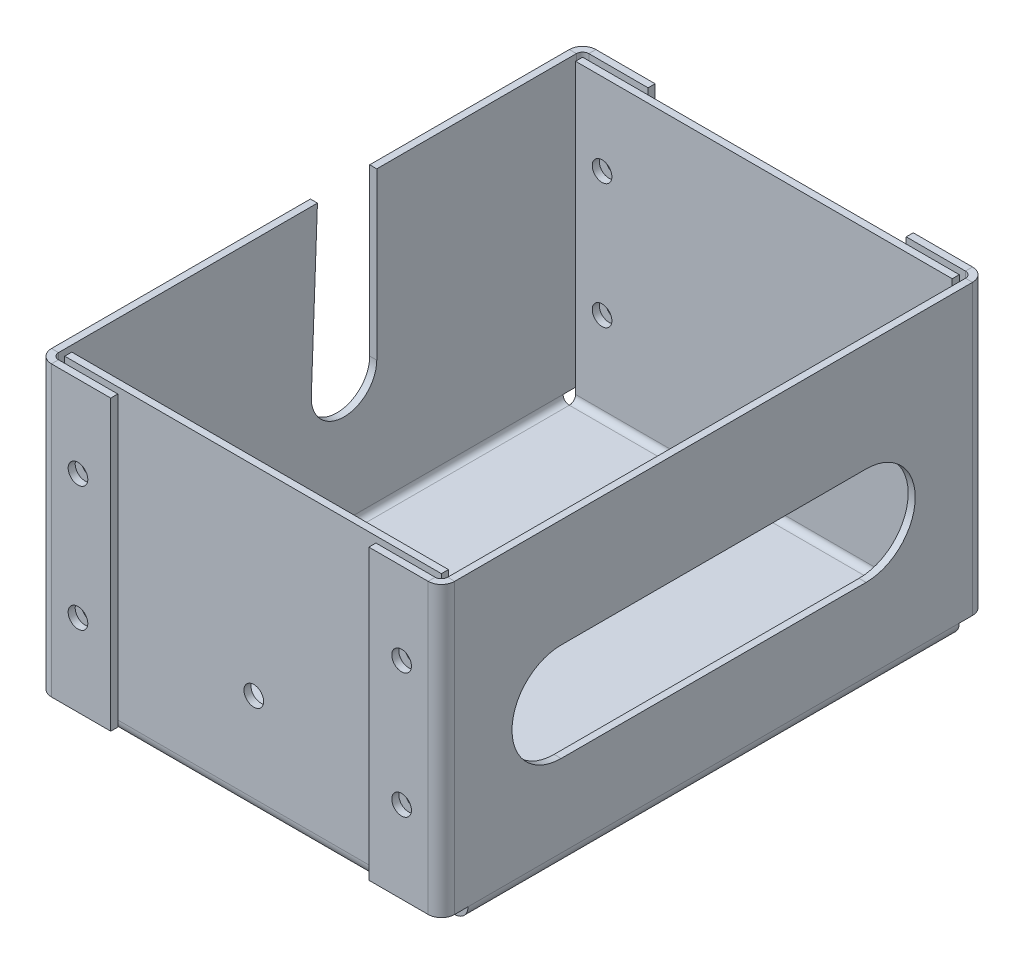
from build123d import *

# Parameters (mm, degrees)
SKETCH2_W                = 46
SKETCH2_H                = 60
BASE_FLANGE1_DEPTH       = 0.86
EDGE_FLANGE1_DEPTH       = 60
EDGE_FLANGE2_DEPTH       = 46
EDGE_FLANGE3_DEPTH       = 60
EDGE_FLANGE5_START       = 0.762
EDGE_FLANGE5_DEPTH       = 35.238
EDGE_FLANGE6_START       = 0.762
EDGE_FLANGE6_DEPTH       = 35.238
M3_CLEARANCE_HOLE1_D     = 3.4
M3_CLEARANCE_HOLE1_DEPTH = 12
M3_CLEARANCE_HOLE1_TIP   = 1.021463052
SKETCH28_R               = 3.4
CUT_EXTRUDE1_DEPTH       = 10
SKETCH29_R               = 4
CUT_EXTRUDE2_DEPTH       = 10
M2_CLEARANCE_HOLE1_D     = 2.4
M2_CLEARANCE_HOLE1_DEPTH = 12
M2_CLEARANCE_HOLE1_TIP   = 0.721032743
M3_CLEARANCE_HOLE2_D     = 3.4
M3_CLEARANCE_HOLE2_DEPTH = 12
M3_CLEARANCE_HOLE2_TIP   = 1.021463052
M2_CLEARANCE_HOLE2_D     = 2.4
M2_CLEARANCE_HOLE4_D     = 2.4
M2_CLEARANCE_HOLE4_DEPTH = 12
M2_CLEARANCE_HOLE4_TIP   = 0.721032743
CUT_EXTRUDE3_DEPTH       = 10
CUT_EXTRUDE4_DEPTH       = 10
CUT_EXTRUDE5_DEPTH       = 10
CUT_EXTRUDE6_DEPTH       = 10
FILLET1_R                = 1
CUT_EXTRUDE7_DEPTH       = 10


# Read off the part's stored shape, not the designer's step: Edge-Flange5, Edge-Flange6
# Sheet-metal steps are written as plain solids
with BuildPart() as part:
    # Sketch2 → Base-Flange1 (new body)
    with BuildSketch(Plane(origin=(0, 0, 0), x_dir=(1, 0, 0), z_dir=(0, 1, 0))):
        Rectangle(SKETCH2_W, SKETCH2_H)
    extrude(amount=-BASE_FLANGE1_DEPTH)

    # Edge-Flange1 section (across the edge) → Edge-Flange1 (add)
    with BuildSketch(Plane(origin=(-23.762, 0, -30), x_dir=(1, 0, 0), z_dir=(0, 0, 1))):
        with BuildLine():
            Line((-0.86, 0.762), (-0.86, 36))
            Line((-0.86, 36), (0, 36))
            Line((0, 36), (0, 0.762))
            ThreePointArc((0, 0.762), (0.223184633, 0.223184633), (0.762, 0))
            Line((0.762, 0), (0.762, -0.86))
            ThreePointArc((0.762, -0.86), (-0.384927199, -0.384927199), (-0.86, 0.762))
        make_face()
    extrude(amount=EDGE_FLANGE1_DEPTH)

    # Edge-Flange2 section (across the edge) → Edge-Flange2 (add)
    with BuildSketch(Plane(origin=(-23, 0, 30.762), x_dir=(0, 0, -1), z_dir=(1, 0, 0))):
        with BuildLine():
            Line((-0.86, 0.762), (-0.86, 36))
            Line((-0.86, 36), (0, 36))
            Line((0, 36), (0, 0.762))
            ThreePointArc((0, 0.762), (0.223184633, 0.223184633), (0.762, 0))
            Line((0.762, 0), (0.762, -0.86))
            ThreePointArc((0.762, -0.86), (-0.384927199, -0.384927199), (-0.86, 0.762))
        make_face()
    edge_flange2 = extrude(amount=EDGE_FLANGE2_DEPTH)

    # Mirror1: Edge-Flange2 across plane
    add(edge_flange2.mirror(Plane.XY))

    # Edge-Flange3 section (across the edge) → Edge-Flange3 (add)
    with BuildSketch(Plane(origin=(23.762, 0, 30), x_dir=(-1, 0, 0), z_dir=(0, 0, -1))):
        with BuildLine():
            Line((-0.86, 0.762), (-0.86, 36))
            Line((-0.86, 36), (0, 36))
            Line((0, 36), (0, 0.762))
            ThreePointArc((0, 0.762), (0.223184633, 0.223184633), (0.762, 0))
            Line((0.762, 0), (0.762, -0.86))
            ThreePointArc((0.762, -0.86), (-0.384927199, -0.384927199), (-0.86, 0.762))
        make_face()
    extrude(amount=EDGE_FLANGE3_DEPTH)

    # Edge-Flange5 outline → Edge-Flange5 (add)
    with BuildSketch(Plane(origin=(0, 0, 0), x_dir=(1, 0, 0), z_dir=(0, 1, 0)).offset(EDGE_FLANGE5_START)):
        with BuildLine():
            ThreePointArc((-24.622, -31.622), (-24.146927199, -32.768927199), (-23, -33.244))
            Line((-23, -33.244), (-15.762, -33.244))
            Line((-15.762, -33.244), (-15.762, -32.384))
            Line((-15.762, -32.384), (-23, -32.384))
            ThreePointArc((-23, -32.384), (-23.538815367, -32.160815367), (-23.762, -31.622))
            Line((-23.762, -31.622), (-23.762, -30))
            Line((-23.762, -30), (-24.622, -30))
            Line((-24.622, -30), (-24.622, -31.622))
        make_face()
    edge_flange5 = extrude(amount=EDGE_FLANGE5_DEPTH)

    # Mirror2: Edge-Flange5 across plane
    add(edge_flange5.mirror(Plane.XY))

    # Edge-Flange6 outline → Edge-Flange6 (add)
    with BuildSketch(Plane(origin=(0, 0, 0), x_dir=(1, 0, 0), z_dir=(0, 1, 0)).offset(EDGE_FLANGE6_START)):
        with BuildLine():
            Line((15.762, -33.244), (23, -33.244))
            ThreePointArc((23, -33.244), (24.146927199, -32.768927199), (24.622, -31.622))
            Line((24.622, -31.622), (24.622, -30))
            Line((24.622, -30), (23.762, -30))
            Line((23.762, -30), (23.762, -31.622))
            ThreePointArc((23.762, -31.622), (23.538815367, -32.160815367), (23, -32.384))
            Line((23, -32.384), (15.762, -32.384))
            Line((15.762, -32.384), (15.762, -33.244))
        make_face()
    edge_flange6 = extrude(amount=EDGE_FLANGE6_DEPTH)

    # Mirror3: Edge-Flange6 across plane
    add(edge_flange6.mirror(Plane.XY))

    # M3 Clearance Hole1
    with Locations(Plane(origin=(0, 0, 0), x_dir=(1, 0, 0), z_dir=(0, 1, 0))):
        with Locations((-20, -27), (20, -27), (-0.5, 27)):
            Hole(M3_CLEARANCE_HOLE1_D / 2, depth=M3_CLEARANCE_HOLE1_DEPTH)
            with Locations((0, 0, -(M3_CLEARANCE_HOLE1_DEPTH + M3_CLEARANCE_HOLE1_TIP / 2))):  # 118° drill point
                Cone(0, M3_CLEARANCE_HOLE1_D / 2, M3_CLEARANCE_HOLE1_TIP, mode=Mode.SUBTRACT)

    # Sketch28 → Cut-Extrude1 (cut)
    with BuildSketch(Plane.ZY.offset(24.622)):
        with Locations(Location((20.78, 15.86, 0), (0, 0, 270))):
            Circle(SKETCH28_R)
    extrude(amount=-CUT_EXTRUDE1_DEPTH, mode=Mode.SUBTRACT)

    # Sketch29 → Cut-Extrude2 (cut)
    with BuildSketch(Plane.ZY.offset(24.622)):
        with Locations(Location((-3.245, 15.762, 0), (0, 0, 270))):
            Circle(SKETCH29_R)
    extrude(amount=-CUT_EXTRUDE2_DEPTH, mode=Mode.SUBTRACT)

    # M2 Clearance Hole1
    with Locations(Plane(origin=(0, -0.86, 0), x_dir=(-1, 0, 0), z_dir=(0, -1, 0))):
        with Locations((-9.869765706, -24.28), (-9.869765706, -18.042)):
            Hole(M2_CLEARANCE_HOLE1_D / 2, depth=M2_CLEARANCE_HOLE1_DEPTH)
            with Locations((0, 0, -(M2_CLEARANCE_HOLE1_DEPTH + M2_CLEARANCE_HOLE1_TIP / 2))):  # 118° drill point
                Cone(0, M2_CLEARANCE_HOLE1_D / 2, M2_CLEARANCE_HOLE1_TIP, mode=Mode.SUBTRACT)

    # M3 Clearance Hole2
    with Locations(Plane(origin=(0, -0.86, 0), x_dir=(-1, 0, 0), z_dir=(0, -1, 0))):
        with Locations((16.23, -6.172321578), (-19.098, -2.172321578), (-19.098, 15.827678422)):
            Hole(M3_CLEARANCE_HOLE2_D / 2, depth=M3_CLEARANCE_HOLE2_DEPTH)
            with Locations((0, 0, -(M3_CLEARANCE_HOLE2_DEPTH + M3_CLEARANCE_HOLE2_TIP / 2))):  # 118° drill point
                Cone(0, M3_CLEARANCE_HOLE2_D / 2, M3_CLEARANCE_HOLE2_TIP, mode=Mode.SUBTRACT)

    # M2 Clearance Hole2 (through all)
    with Locations(Plane.XY.offset(33.244)):
        with Locations((-19.762, 26), (-19.762, 10.762), (19.762, 26), (19.762, 10.754739314)):
            Hole(M2_CLEARANCE_HOLE2_D / 2)

    # M2 Clearance Hole4
    with Locations(Plane(origin=(0, 0, 30.762), x_dir=(-1, 0, 0), z_dir=(0, 0, -1))):
        with Locations((-0.088, 11.622)):
            Hole(M2_CLEARANCE_HOLE4_D / 2, depth=M2_CLEARANCE_HOLE4_DEPTH)
            with Locations((0, 0, -(M2_CLEARANCE_HOLE4_DEPTH + M2_CLEARANCE_HOLE4_TIP / 2))):  # 118° drill point
                Cone(0, M2_CLEARANCE_HOLE4_D / 2, M2_CLEARANCE_HOLE4_TIP, mode=Mode.SUBTRACT)

    # Sketch40 → Cut-Extrude3 (cut)
    with BuildSketch(Plane(origin=(24.622, 0, 0), x_dir=(0, 0, -1), z_dir=(1, 0, 0))):
        with BuildLine():
            Line((-18.622, 22.762), (18.622, 22.762))
            ThreePointArc((18.622, 22.762), (24.622, 16.762), (18.622, 10.762))
            Line((18.622, 10.762), (-18.622, 10.762))
            ThreePointArc((-18.622, 10.762), (-24.622, 16.762), (-18.622, 22.762))
        make_face()
    extrude(amount=-CUT_EXTRUDE3_DEPTH, mode=Mode.SUBTRACT)

    # Sketch42 → Cut-Extrude4 (cut)
    with BuildSketch(Plane(origin=(0, -0.86, 0), x_dir=(-1, 0, 0), z_dir=(0, -1, 0))):
        Polygon((14.53, -6.172321578), (14.53, -9.623545208), (17.93, -9.623545208), (17.93, -7.872321578), (19.704080783, -7.872321578), (19.704080783, -4.002766759), (14.53, -4.002766759), align=None)
    extrude(amount=-CUT_EXTRUDE4_DEPTH, mode=Mode.SUBTRACT)

    # Sketch41 → Cut-Extrude5 (cut)
    with BuildSketch(Plane.XZ.offset(0.86)):
        Polygon((20.798, 2.172321578), (20.798, 5.793483038), (17.398, 5.793483038), (17.398, 4.094032768), (15.692713332, 4.094032768), (15.692713332, 0.472321578), (20.798, 0.472321578), align=None)
    extrude(amount=-CUT_EXTRUDE5_DEPTH, mode=Mode.SUBTRACT)

    # Sketch43 → Cut-Extrude6 (cut)
    with BuildSketch(Plane(origin=(0, -0.86, 0), x_dir=(-1, 0, 0), z_dir=(0, -1, 0))):
        Polygon((-20.798, 15.827678422), (-20.798, 11.962799488), (-17.398, 11.962799488), (-17.398, 13.726356469), (-15.657296152, 13.726356469), (-15.657296152, 17.527678422), (-20.798, 17.527678422), align=None)
    extrude(amount=-CUT_EXTRUDE6_DEPTH, mode=Mode.SUBTRACT)

    # Fillet1
    fillet1_edges = [part.edges().sort_by_distance(p)[0] for p in [
        (-17.93, -0.43, 7.872321578),
        (17.398, -0.43, 4.094032768),
        (17.398, -0.43, -13.726356469),
    ]]
    fillet(fillet1_edges, radius=FILLET1_R)

    # Sketch44 → Cut-Extrude7 (cut)
    with BuildSketch(Plane.ZY.offset(24.622)):
        Polygon((0.755, 15.762), (0, 36), (-7.245, 36), (-7.245, 15.762), align=None)
    extrude(amount=-CUT_EXTRUDE7_DEPTH, mode=Mode.SUBTRACT)


solid = part.part
